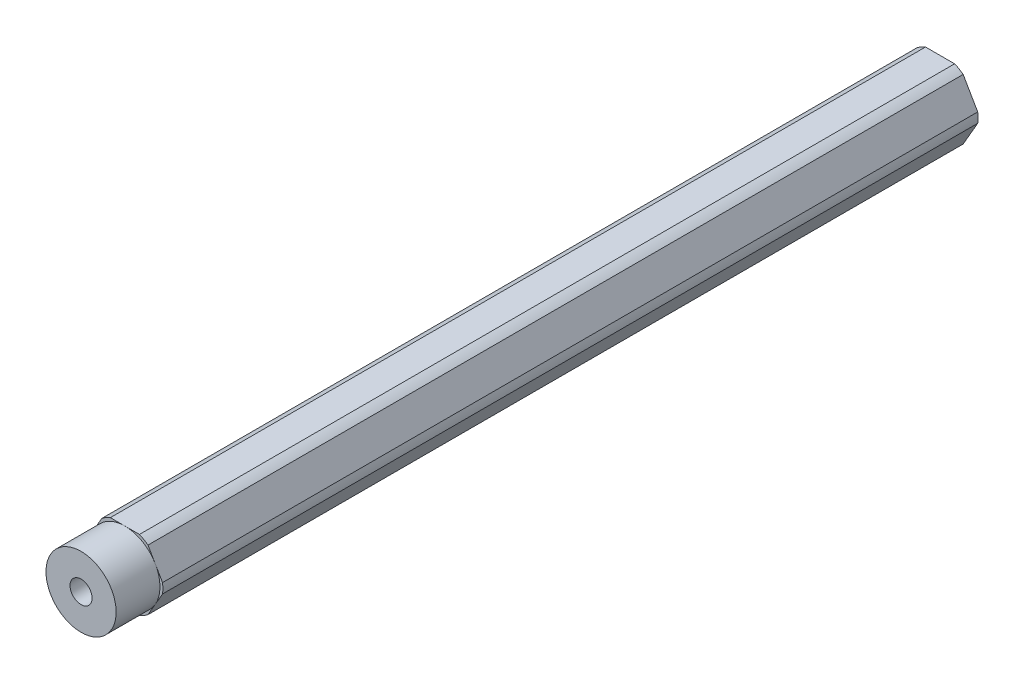
from build123d import *

# Parameters (mm, degrees)
SKETCH1_R           = 2.000000064
BOSS_EXTRUDE1_DEPTH = 73.79335
SKETCH4_R           = 6.35
SKETCH4_R_2         = 2.000000064
BOSS_EXTRUDE2_DEPTH = 7.9375


with BuildPart() as part:
    # Sketch1 → Boss-Extrude1 (new, symmetric)
    with BuildSketch(Plane.XY):
        with BuildLine():
            ThreePointArc((4.181770846, 5.456960429), (3.437499983, 5.953924622), (2.634980936, 6.35))
            Line((2.634980936, 6.35), (-2.634980936, 6.35))
            ThreePointArc((-2.634980936, 6.35), (-3.437499983, 5.953924622), (-4.181770846, 5.456960429))
            Line((-4.181770846, 5.456960429), (-6.816751782, 0.893039571))
            ThreePointArc((-6.816751782, 0.893039571), (-6.874999966, 0), (-6.816751782, -0.893039571))
            Line((-6.816751782, -0.893039571), (-4.181770846, -5.456960429))
            ThreePointArc((-4.181770846, -5.456960429), (-3.437499983, -5.953924622), (-2.634980936, -6.35))
            Line((-2.634980936, -6.35), (2.634980936, -6.35))
            ThreePointArc((2.634980936, -6.35), (3.437499983, -5.953924622), (4.181770846, -5.456960429))
            Line((4.181770846, -5.456960429), (6.816751782, -0.893039571))
            ThreePointArc((6.816751782, -0.893039571), (6.860422465, -0.447468582), (6.874999966, 0))
            ThreePointArc((6.874999966, 0), (6.860422465, 0.447468582), (6.816751782, 0.893039571))
            Line((6.816751782, 0.893039571), (4.181770846, 5.456960429))
        make_face()
        Circle(SKETCH1_R, mode=Mode.SUBTRACT)
    extrude(amount=BOSS_EXTRUDE1_DEPTH, both=True)

    # Sketch4 → Boss-Extrude2 (add)
    with BuildSketch(Plane.XY.offset(73.79335)):
        Circle(SKETCH4_R)
        Circle(SKETCH4_R_2, mode=Mode.SUBTRACT)
    extrude(amount=BOSS_EXTRUDE2_DEPTH)


solid = part.part
